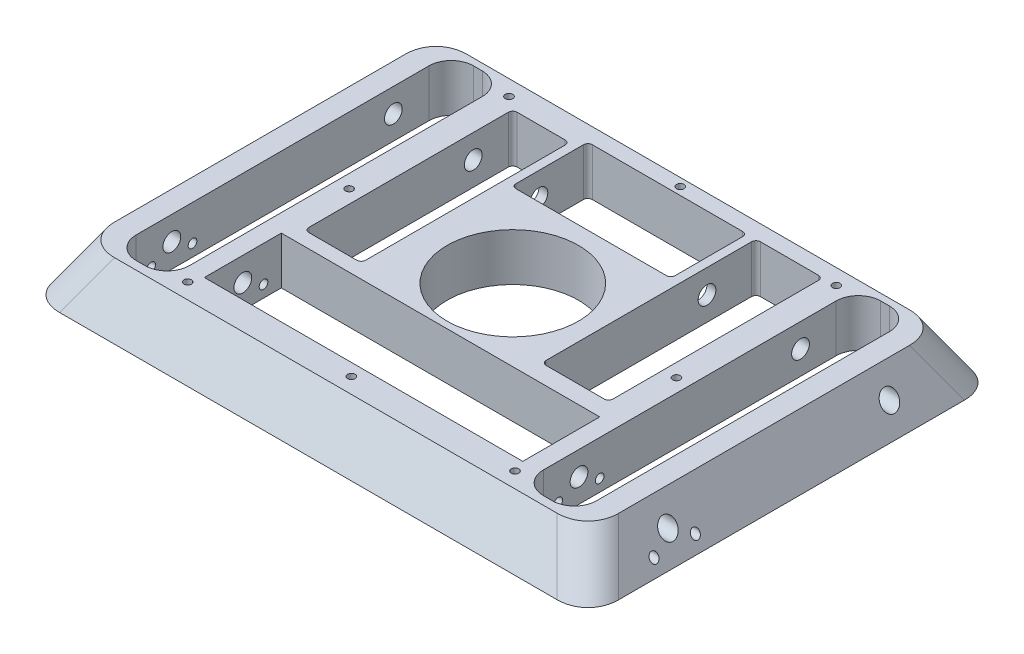
from build123d import *

# Parameters (mm, degrees)
SKETCH1_W                 = 200.025
SKETCH1_H                 = 155.956
SKETCH1_R                 = 23.495
SKETCH1_W_2               = 113.919
SKETCH1_H_2               = 27.54
BOSS_EXTRUDE1_DEPTH       = 17
SKETCH2_R                 = 3.175
CUT_EXTRUDE1_DEPTH        = 216.359163049
SKETCH3_R                 = 1.55
CUT_EXTRUDE2_DEPTH        = 216.359163049
CHAMFER1_SIZE             = 14.664696837
CHAMFER1_SIZE_2           = 25.4
CHAMFER2_SIZE             = 26.396454307
CHAMFER2_SIZE_2           = 15.24
CUT_EXTRUDE5_DEPTH        = 126.056955969
FILLET1_R                 = 12.7
TAP_DRILL_FOR_6_32_TAP1_D = 2.7051


with BuildPart() as part:
    # Sketch1 → Boss-Extrude1 (new body)
    with BuildSketch(Plane(origin=(0, 0, 0), x_dir=(1, 0, 0), z_dir=(0, 1, 0))):
        Rectangle(SKETCH1_W, SKETCH1_H)
        with Locations(Location((0, 0, 0), (0, 0, 270))):
            Circle(SKETCH1_R, mode=Mode.SUBTRACT)
        with BuildLine():
            Line((-74.422, 60.325), (-71.247, 60.325))
            ThreePointArc((-71.247, 60.325), (-65.634339924, 58.000160076), (-63.3095, 52.3875))
            Line((-63.3095, 52.3875), (-63.3095, -52.3875))
            ThreePointArc((-63.3095, -52.3875), (-65.634339924, -58.000160076), (-71.247, -60.325))
            Line((-71.247, -60.325), (-74.422, -60.325))
            ThreePointArc((-74.422, -60.325), (-80.034660076, -58.000160076), (-82.3595, -52.3875))
            Line((-82.3595, -52.3875), (-82.3595, 52.3875))
            ThreePointArc((-82.3595, 52.3875), (-80.034660076, 58.000160076), (-74.422, 60.325))
        make_face(mode=Mode.SUBTRACT)
        with BuildLine():
            Line((74.422, -60.325), (71.247, -60.325))
            ThreePointArc((71.247, -60.325), (65.634339924, -58.000160076), (63.3095, -52.3875))
            Line((63.3095, -52.3875), (63.3095, 52.3875))
            ThreePointArc((63.3095, 52.3875), (65.634339924, 58.000160076), (71.247, 60.325))
            Line((71.247, 60.325), (74.422, 60.325))
            ThreePointArc((74.422, 60.325), (80.034660076, 58.000160076), (82.3595, 52.3875))
            Line((82.3595, 52.3875), (82.3595, -52.3875))
            ThreePointArc((82.3595, -52.3875), (80.034660076, -58.000160076), (74.422, -60.325))
        make_face(mode=Mode.SUBTRACT)
        with Locations((0, -39.624)):
            Rectangle(SKETCH1_W_2, SKETCH1_H_2, mode=Mode.SUBTRACT)
        with BuildLine():
            Line((-53.7845, -19.1865), (-53.7845, 52.1785))
            ThreePointArc((-53.7845, 52.1785), (-53.319532015, 53.301032015), (-52.197, 53.766))
            Line((-52.197, 53.766), (-35.052, 53.766))
            ThreePointArc((-35.052, 53.766), (-33.929467985, 53.301032015), (-33.4645, 52.1785))
            Line((-33.4645, 52.1785), (-33.4645, -19.1865))
            ThreePointArc((-33.4645, -19.1865), (-33.929467985, -20.309032015), (-35.052, -20.774))
            Line((-35.052, -20.774), (-52.197, -20.774))
            ThreePointArc((-52.197, -20.774), (-53.319532015, -20.309032015), (-53.7845, -19.1865))
        make_face(mode=Mode.SUBTRACT)
        with BuildLine():
            Line((52.197, -19.504), (31.4325, -19.504))
            ThreePointArc((31.4325, -19.504), (30.309967985, -19.039032015), (29.845, -17.9165))
            Line((29.845, -17.9165), (29.845, 55.5625))
            ThreePointArc((29.845, 55.5625), (30.309967985, 56.685032015), (31.4325, 57.15))
            Line((31.4325, 57.15), (52.197, 57.15))
            ThreePointArc((52.197, 57.15), (53.319532015, 56.685032015), (53.7845, 55.5625))
            Line((53.7845, 55.5625), (53.7845, -17.9165))
            ThreePointArc((53.7845, -17.9165), (53.319532015, -19.039032015), (52.197, -19.504))
        make_face(mode=Mode.SUBTRACT)
        with BuildLine():
            Line((25.0825, 57.15), (-28.702, 57.15))
            ThreePointArc((-28.702, 57.15), (-29.824532015, 56.685032015), (-30.2895, 55.5625))
            Line((-30.2895, 55.5625), (-30.2895, 31.4325))
            ThreePointArc((-30.2895, 31.4325), (-29.824532015, 30.309967985), (-28.702, 29.845))
            Line((-28.702, 29.845), (25.0825, 29.845))
            ThreePointArc((25.0825, 29.845), (26.205032015, 30.309967985), (26.67, 31.4325))
            Line((26.67, 31.4325), (26.67, 55.5625))
            ThreePointArc((26.67, 55.5625), (26.205032015, 56.685032015), (25.0825, 57.15))
        make_face(mode=Mode.SUBTRACT)
    extrude(amount=BOSS_EXTRUDE1_DEPTH)

    # Sketch2 → Cut-Extrude1 (cut, through all)
    with BuildSketch(Plane.ZY.offset(100.0125)):
        with Locations((39.624, 8.491)):
            Circle(SKETCH2_R)
        with Locations((-39.624, 8.491)):
            Circle(SKETCH2_R)
    extrude(amount=-CUT_EXTRUDE1_DEPTH, mode=Mode.SUBTRACT)

    # Sketch3 → Cut-Extrude2 (cut, through all)
    with BuildSketch(Plane.ZY.offset(100.0125)):
        with Locations((47.018965788, 4.3)):
            Circle(SKETCH3_R)
        with Locations((32.229034212, 4.3)):
            Circle(SKETCH3_R)
    extrude(amount=-CUT_EXTRUDE2_DEPTH, mode=Mode.SUBTRACT)

    # Chamfer1
    # the kernel refuses this chamfer: 25.4, 14.664696837 mm, written as the material it takes off along each edge
    with BuildSketch(Plane(origin=(165.724478168, 17, 77.978), x_dir=(0, 0.05789386240267079, -0.9983227437537926), z_dir=(-1, 0, 0))) as chamfer1_piece_1:
        Polygon((CHAMFER1_SIZE * 0.998322743782, CHAMFER1_SIZE * 0.0578938624043), (-CHAMFER1_SIZE_2 * 0.0578938624027, CHAMFER1_SIZE_2 * 0.998322743754), (0, 0), align=None)
    extrude(amount=331.448956336, mode=Mode.SUBTRACT)

    # Chamfer2
    # the kernel refuses this chamfer: 26.396454307, 15.24 mm, written as the material it takes off along each edge
    with BuildSketch(Plane(origin=(-168.302390912, 17, -77.978), x_dir=(0, -0.9998132206222079, -0.01932676561270073), z_dir=(1, 0, 0))) as chamfer2_piece_1:
        Polygon((CHAMFER2_SIZE * 0.999813220635, -CHAMFER2_SIZE * 0.019326765613), (-CHAMFER2_SIZE_2 * 0.0193267656127, -CHAMFER2_SIZE_2 * 0.999813220622), (0, 0), align=None)
    extrude(amount=336.604781823, mode=Mode.SUBTRACT)

    # Sketch5 → Cut-Extrude5 (cut, symmetric)
    with BuildSketch(Plane.XY):
        Polygon((100.0125, 0), (90.197545424, 17), (100.0125, 17), align=None)
    cut_extrude5 = extrude(amount=CUT_EXTRUDE5_DEPTH, both=True, mode=Mode.SUBTRACT)

    # Mirror1: Cut-Extrude5 across plane
    add(cut_extrude5.mirror(Plane(origin=(0, 0, 0), x_dir=(0, 0, 1), z_dir=(1, 0, 0))), mode=Mode.SUBTRACT)

    # Fillet1
    fillet1_edges = [part.edges().sort_by_distance(p)[0] for p in [
        (95.105022712, 8.5, -67.645477288),
        (95.105022712, 8.5, 68.220780451),
        (-95.105022712, 8.5, -67.645477288),
        (-95.105022712, 8.5, 68.220780451),
    ]]
    fillet(fillet1_edges, radius=FILLET1_R)

    # Tap Drill for #6-32 Tap1 (through all)
    with Locations(Plane(origin=(0, 17, 0), x_dir=(1, 0, 0), z_dir=(0, 1, 0))):
        with Locations((-58.547, 57.18175), (-58.547, 0), (-58.547, -57.757053163), (58.547, -57.757053163), (58.547, 0), (58.547, 57.18175), (0, 59.906875137), (0, -57.757053163)):
            Hole(TAP_DRILL_FOR_6_32_TAP1_D / 2)


solid = part.part
